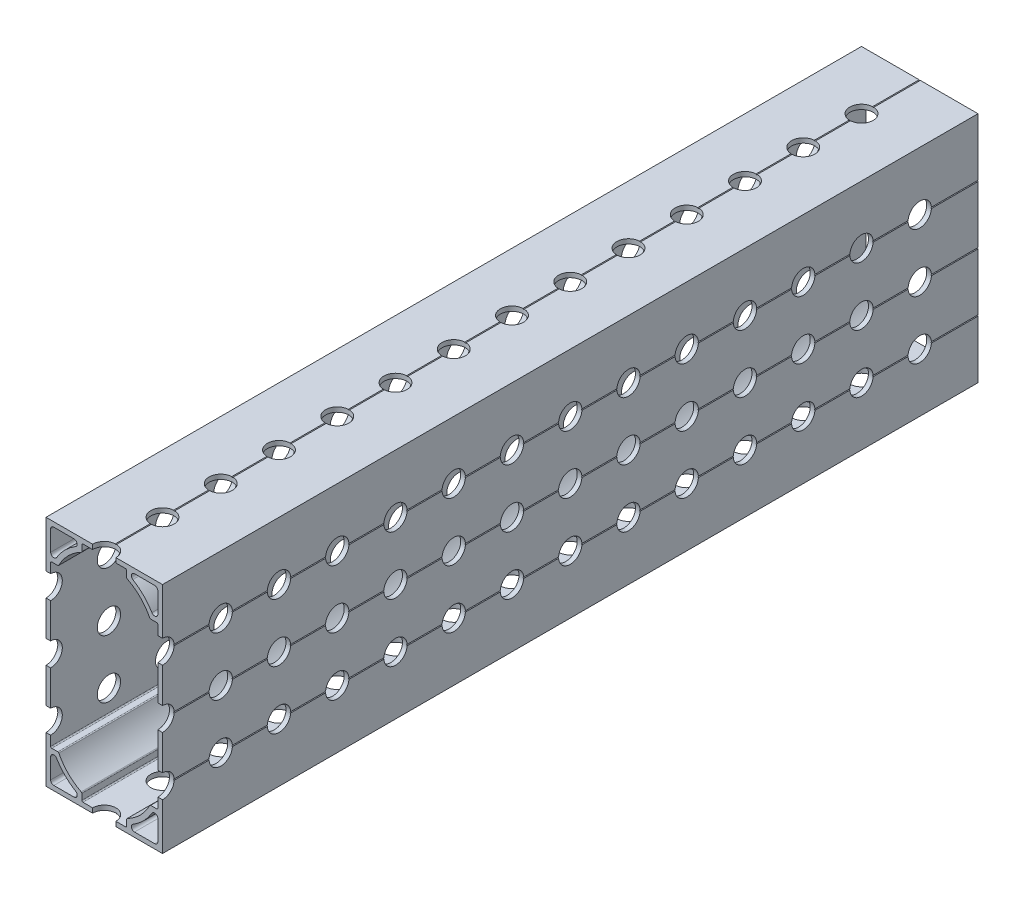
from build123d import *

# Parameters (mm, degrees)
BOSS_EXTRUDE1_DEPTH = 177.8
SKETCH2_R           = 2.54
CUT_EXTRUDE1_DEPTH  = 189.799073091
LPATTERN1_COUNT     = 95
LPATTERN1_PITCH     = 12.7
FILLET1_R           = 0.254
SKETCH4_R           = 2.54
CUT_EXTRUDE2_DEPTH  = 182.392282085
LPATTERN2_COUNT     = 94
LPATTERN2_PITCH     = 12.7


with BuildPart() as part:
    # Sketch3 → Boss-Extrude1 (new body)
    with BuildSketch(Plane.XY):
        Polygon((0.127, -25.4), (12.7, -25.4), (12.7, -12.827), (12.573, -12.7), (12.7, -12.573), (12.7, -0.127), (12.573, 0), (12.7, 0.127), (12.7, 12.573), (12.573, 12.7), (12.7, 12.827), (12.7, 25.4), (0.127, 25.4), (0, 25.273), (-0.127, 25.4), (-12.7, 25.4), (-12.7, 12.827), (-12.573, 12.7), (-12.7, 12.573), (-12.7, 0.127), (-12.573, 0), (-12.7, -0.127), (-12.7, -12.573), (-12.573, -12.7), (-12.7, -12.827), (-12.7, -25.4), (-0.127, -25.4), (0, -25.273), align=None)
        with BuildLine():
            Line((-6.597089026, -24.384), (-10.992410974, -24.384))
            ThreePointArc((-10.992410974, -24.384), (-11.481438264, -24.181438264), (-11.684, -23.692410974))
            Line((-11.684, -23.692410974), (-11.684, -19.297089026))
            ThreePointArc((-11.684, -19.297089026), (-11.177055919, -18.630604499), (-10.39941737, -18.941204261))
            ThreePointArc((-10.39941737, -18.941204261), (-8.576144596, -21.276144596), (-6.241204261, -23.09941737))
            ThreePointArc((-6.241204261, -23.09941737), (-5.930604499, -23.877055919), (-6.597089026, -24.384))
        make_face(mode=Mode.SUBTRACT)
        with BuildLine():
            ThreePointArc((10.39941737, -18.941204261), (11.177055919, -18.630604499), (11.684, -19.297089026))
            Line((11.684, -19.297089026), (11.684, -23.692410974))
            ThreePointArc((11.684, -23.692410974), (11.481438264, -24.181438264), (10.992410974, -24.384))
            Line((10.992410974, -24.384), (6.597089026, -24.384))
            ThreePointArc((6.597089026, -24.384), (5.930604499, -23.877055919), (6.241204261, -23.09941737))
            ThreePointArc((6.241204261, -23.09941737), (8.576144596, -21.276144596), (10.39941737, -18.941204261))
        make_face(mode=Mode.SUBTRACT)
        with BuildLine():
            Line((11.684, 17.5895), (11.684, 0))
            Line((11.684, 0), (11.684, -17.5895))
            Line((11.684, -17.5895), (9.979000251, -17.5895))
            ThreePointArc((9.979000251, -17.5895), (7.857724106, -20.557724106), (4.8895, -22.679000251))
            Line((4.8895, -22.679000251), (4.8895, -24.384))
            Line((4.8895, -24.384), (-4.8895, -24.384))
            Line((-4.8895, -24.384), (-4.8895, -22.679000251))
            ThreePointArc((-4.8895, -22.679000251), (-7.857724106, -20.557724106), (-9.979000251, -17.5895))
            Line((-9.979000251, -17.5895), (-11.684, -17.5895))
            Line((-11.684, -17.5895), (-11.684, 0))
            Line((-11.684, 0), (-11.684, 17.5895))
            Line((-11.684, 17.5895), (-9.979000251, 17.5895))
            ThreePointArc((-9.979000251, 17.5895), (-7.857724106, 20.557724106), (-4.8895, 22.679000251))
            Line((-4.8895, 22.679000251), (-4.8895, 24.384))
            Line((-4.8895, 24.384), (4.8895, 24.384))
            Line((4.8895, 24.384), (4.8895, 22.679000251))
            ThreePointArc((4.8895, 22.679000251), (7.857724106, 20.557724106), (9.979000251, 17.5895))
            Line((9.979000251, 17.5895), (11.684, 17.5895))
        make_face(mode=Mode.SUBTRACT)
        with BuildLine():
            ThreePointArc((-10.39941737, 18.941204261), (-11.177055919, 18.630604499), (-11.684, 19.297089026))
            Line((-11.684, 19.297089026), (-11.684, 23.692410974))
            ThreePointArc((-11.684, 23.692410974), (-11.481438264, 24.181438264), (-10.992410974, 24.384))
            Line((-10.992410974, 24.384), (-6.597089026, 24.384))
            ThreePointArc((-6.597089026, 24.384), (-5.930604499, 23.877055919), (-6.241204261, 23.09941737))
            ThreePointArc((-6.241204261, 23.09941737), (-8.576144596, 21.276144596), (-10.39941737, 18.941204261))
        make_face(mode=Mode.SUBTRACT)
        with BuildLine():
            Line((6.597089026, 24.384), (10.992410974, 24.384))
            ThreePointArc((10.992410974, 24.384), (11.481438264, 24.181438264), (11.684, 23.692410974))
            Line((11.684, 23.692410974), (11.684, 19.297089026))
            ThreePointArc((11.684, 19.297089026), (11.177055919, 18.630604499), (10.39941737, 18.941204261))
            ThreePointArc((10.39941737, 18.941204261), (8.576144596, 21.276144596), (6.241204261, 23.09941737))
            ThreePointArc((6.241204261, 23.09941737), (5.930604499, 23.877055919), (6.597089026, 24.384))
        make_face(mode=Mode.SUBTRACT)
    extrude(amount=BOSS_EXTRUDE1_DEPTH)

    # Sketch2 → Cut-Extrude1 (cut, through all)
    with BuildSketch(Plane(origin=(25.4, 25.4, 0), x_dir=(0, 0, 1), z_dir=(0, -1, 0))):
        with Locations((12.7, 25.4)):
            Circle(SKETCH2_R)
    cut_extrude1 = extrude(amount=CUT_EXTRUDE1_DEPTH, mode=Mode.SUBTRACT)

    # LPattern1: Cut-Extrude1 ×95
    with Locations(*[(0, 0, i * LPATTERN1_PITCH) for i in range(1, LPATTERN1_COUNT)]):
        add(cut_extrude1, mode=Mode.SUBTRACT)

    # Fillet1
    fillet1_edges = [part.edges().sort_by_distance(p)[0] for p in [
        (9.979000251, 17.5895, 88.9),
        (11.684, 17.5895, 88.9),
        (4.8895, 22.679000251, 88.9),
        (4.8895, 24.384, 88.9),
        (11.684, -17.5895, 88.9),
        (9.979000251, -17.5895, 88.9),
        (4.8895, -22.679000251, 88.9),
        (4.8895, -24.384, 88.9),
        (-4.8895, -22.679000251, 88.9),
        (-4.8895, -24.384, 88.9),
        (-9.979000251, -17.5895, 88.9),
        (-11.684, -17.5895, 88.9),
        (-4.8895, 24.384, 88.9),
        (-4.8895, 22.679000251, 88.9),
        (-11.684, 17.5895, 88.9),
        (-9.979000251, 17.5895, 88.9),
    ]]
    fillet(fillet1_edges, radius=FILLET1_R)

    # Sketch4 → Cut-Extrude2 (cut, through all)
    with BuildSketch(Plane(origin=(12.7, 0, 0), x_dir=(0, 0, -1), z_dir=(1, 0, 0))):
        with Locations((-12.7, 12.7)):
            Circle(SKETCH4_R)
        with Locations((-12.7, 0)):
            Circle(SKETCH4_R)
        with Locations((-12.7, -12.7)):
            Circle(SKETCH4_R)
    cut_extrude2 = extrude(amount=-CUT_EXTRUDE2_DEPTH, mode=Mode.SUBTRACT)

    # LPattern2: Cut-Extrude2 ×94
    with Locations(*[(0, 0, i * LPATTERN2_PITCH) for i in range(1, LPATTERN2_COUNT)]):
        add(cut_extrude2, mode=Mode.SUBTRACT)


solid = part.part
